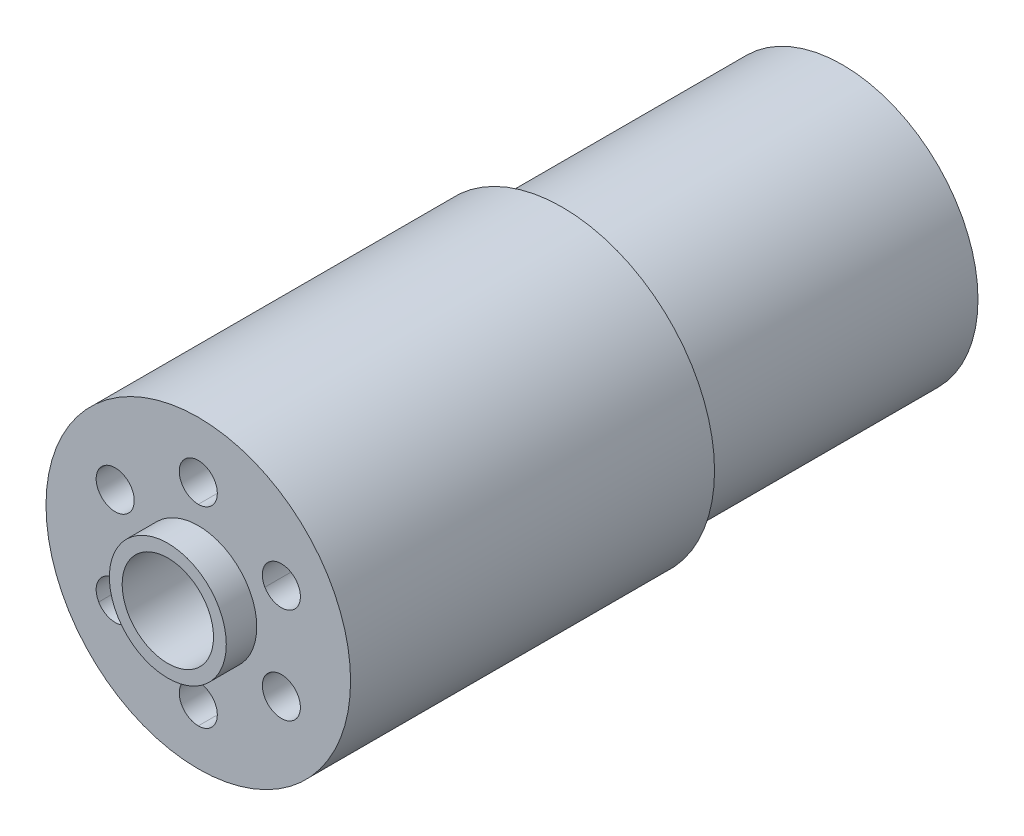
from build123d import *
from build123d.topology import SkipClean

# Parameters (mm, degrees)
SKETCH1_R           = 25.4
BOSS_EXTRUDE2_DEPTH = 107.442
SKETCH6_R           = 7.62
SKETCH6_R_2         = 3.175
CUT_EXTRUDE1_DEPTH  = 108.458
SKETCH7_R           = 25.4
SKETCH7_R_2         = 22.606
CUT_EXTRUDE2_DEPTH  = 46.736
SKETCH8_R           = 9.75
SKETCH8_R_2         = 7.62
BOSS_EXTRUDE7_DEPTH = 5.08
BOSS_EXTRUDE8_START = 5.08
SKETCH9_R           = 9.75
SKETCH9_R_2         = 7.62
BOSS_EXTRUDE8_DEPTH = 5.08


with BuildPart() as part:
    # Sketch1 → Boss-Extrude2 (new body)
    with BuildSketch(Plane.XY):
        Circle(SKETCH1_R)
    extrude(amount=BOSS_EXTRUDE2_DEPTH)

    # Sketch6 → Cut-Extrude1 (cut)
    with BuildSketch(Plane(origin=(0, 0, 0), x_dir=(-1, 0, 0), z_dir=(0, 0, -1))):
        Circle(SKETCH6_R)
        with Locations((-13.858138511, 8.001)):
            Circle(SKETCH6_R_2)
        with Locations((0, 16.002)):
            Circle(SKETCH6_R_2)
        with Locations((13.858138511, 8.001)):
            Circle(SKETCH6_R_2)
        with Locations((13.858138511, -8.001)):
            Circle(SKETCH6_R_2)
        with Locations((0, -16.002)):
            Circle(SKETCH6_R_2)
        with Locations((-13.858138511, -8.001)):
            Circle(SKETCH6_R_2)
    extrude(amount=-CUT_EXTRUDE1_DEPTH, mode=Mode.SUBTRACT)

    # Sketch7 → Cut-Extrude2 (cut)
    with BuildSketch(Plane(origin=(0, 0, 0), x_dir=(-1, 0, 0), z_dir=(0, 0, -1))):
        Circle(SKETCH7_R)
        Circle(SKETCH7_R_2, mode=Mode.SUBTRACT)
    extrude(amount=-CUT_EXTRUDE2_DEPTH, mode=Mode.SUBTRACT)

    # Sketch8 → Boss-Extrude7 (add)
    with SkipClean():  # the faces are left unmerged after this step: merging them gives an invalid solid
        with BuildSketch(Plane.XY.offset(107.442)):
            Circle(SKETCH8_R)
            Circle(SKETCH8_R_2, mode=Mode.SUBTRACT)
        extrude(amount=BOSS_EXTRUDE7_DEPTH)

    # Sketch9 → Boss-Extrude8 (add)
    with SkipClean():  # the faces are left unmerged after this step: merging them gives an invalid solid
        with BuildSketch(Plane(origin=(0, 0, 0), x_dir=(-1, 0, 0), z_dir=(0, 0, -1)).offset(BOSS_EXTRUDE8_START)):
            Circle(SKETCH9_R)
            Circle(SKETCH9_R_2, mode=Mode.SUBTRACT)
        extrude(amount=-BOSS_EXTRUDE8_DEPTH)


solid = part.part
